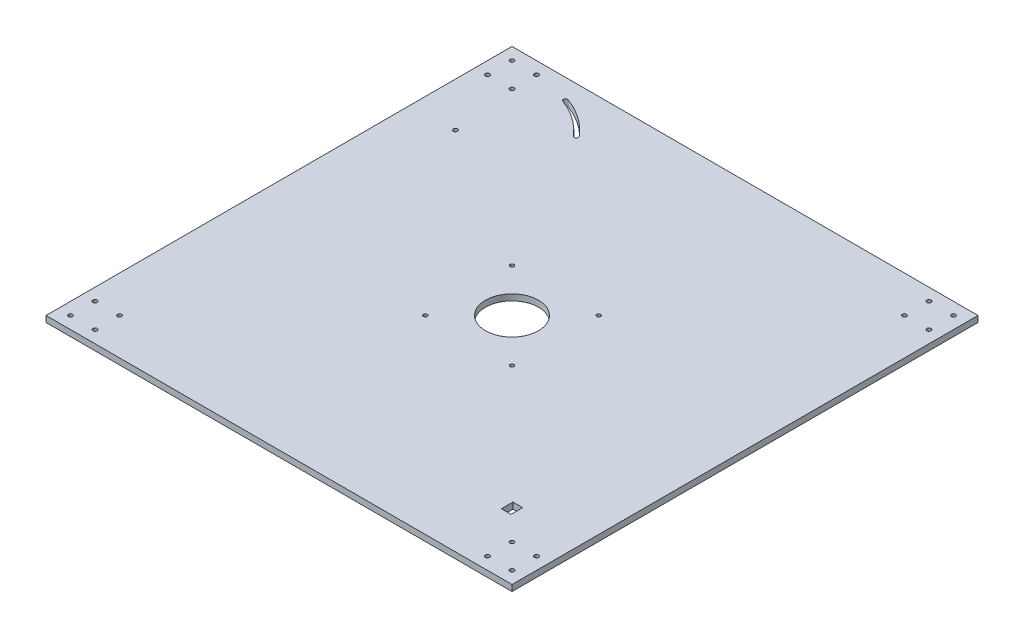
from build123d import *

# Parameters (mm, degrees)
SKETCH1_W               = 482.6
SKETCH1_H               = 482.6
BOSS_EXTRUDE1_DEPTH     = 6.35
CUT_EXTRUDE1_DEPTH      = 342.30880812
CUT_EXTRUDE1_DEPTH_BACK = 342.30880812
SKETCH2_R               = 1.984375
SKETCH2_R_2             = 27.432
SKETCH3_W               = 10
SKETCH3_H               = 12
CUT_EXTRUDE2_DEPTH      = 342.30880812
SKETCH4_R               = 2.1828125
CUT_EXTRUDE3_DEPTH      = 342.30880812
SKETCH5_R               = 2.1828125
CUT_EXTRUDE4_DEPTH      = 342.30880812


with BuildPart() as part:
    # Sketch1 → Boss-Extrude1 (new body)
    with BuildSketch(Plane(origin=(0, 0, 0), x_dir=(1, 0, 0), z_dir=(0, 1, 0))):
        Rectangle(SKETCH1_W, SKETCH1_H)
    extrude(amount=BOSS_EXTRUDE1_DEPTH)

    # Sketch2 → Cut-Extrude1 (cut, two sides: drawn at the far end of the back side and taken through both)
    with BuildSketch(Plane(origin=(0, 6.35, 0), x_dir=(1, 0, 0), z_dir=(0, 1, 0)).offset(-CUT_EXTRUDE1_DEPTH_BACK)):
        with Locations((-44.8437, 44.8437)):
            Circle(SKETCH2_R)
        with Locations((44.8437, 44.8437)):
            Circle(SKETCH2_R)
        with Locations((-44.8437, -44.8437)):
            Circle(SKETCH2_R)
        with Locations((44.8437, -44.8437)):
            Circle(SKETCH2_R)
        Circle(SKETCH2_R_2)
    extrude(amount=CUT_EXTRUDE1_DEPTH + CUT_EXTRUDE1_DEPTH_BACK, mode=Mode.SUBTRACT)

    # Sketch3 → Cut-Extrude2 (cut, through all)
    with BuildSketch(Plane(origin=(0, 6.35, 0), x_dir=(1, 0, 0), z_dir=(0, 1, 0))):
        with Locations((172.869930331, -172.869930331)):
            Rectangle(SKETCH3_W, SKETCH3_H)
    extrude(amount=-CUT_EXTRUDE2_DEPTH, mode=Mode.SUBTRACT)

    # Sketch4 → Cut-Extrude3 (cut, through all)
    with BuildSketch(Plane(origin=(0, 6.35, 0), x_dir=(1, 0, 0), z_dir=(0, 1, 0))):
        with Locations((-228.6, 228.6)):
            Circle(SKETCH4_R)
        with Locations((-203.2, 228.6)):
            Circle(SKETCH4_R)
        with Locations((-228.6, 203.2)):
            Circle(SKETCH4_R)
        with Locations((-203.2, 203.2)):
            Circle(SKETCH4_R)
        with Locations((203.2, 228.6)):
            Circle(SKETCH4_R)
        with Locations((203.2, 203.2)):
            Circle(SKETCH4_R)
        with Locations((228.6, 203.2)):
            Circle(SKETCH4_R)
        with Locations((228.6, 228.6)):
            Circle(SKETCH4_R)
        with Locations((203.2, -203.2)):
            Circle(SKETCH4_R)
        with Locations((228.6, -203.2)):
            Circle(SKETCH4_R)
        with Locations((228.6, -228.6)):
            Circle(SKETCH4_R)
        with Locations((203.2, -228.6)):
            Circle(SKETCH4_R)
        with Locations((-228.6, -203.2)):
            Circle(SKETCH4_R)
        with Locations((-203.2, -203.2)):
            Circle(SKETCH4_R)
        with Locations((-203.2, -228.6)):
            Circle(SKETCH4_R)
        with Locations((-228.6, -228.6)):
            Circle(SKETCH4_R)
    extrude(amount=-CUT_EXTRUDE3_DEPTH, mode=Mode.SUBTRACT)

    # Sketch5 → Cut-Extrude4 (cut, through all)
    with BuildSketch(Plane(origin=(0, 6.35, 0), x_dir=(1, 0, 0), z_dir=(0, 1, 0))):
        with Locations((-195.580742094, 136.947109943)):
            Circle(SKETCH5_R)
        with BuildLine():
            ThreePointArc((-125.807259715, 195.494013274), (-143.337787088, 211.557782002), (-164.428585509, 222.53695673))
            ThreePointArc((-164.428585509, 222.53695673), (-167.226324152, 221.232349775), (-165.921717197, 218.434611132))
            ThreePointArc((-165.921717197, 218.434611132), (-145.841806718, 207.981671359), (-129.151522487, 192.687843615))
            ThreePointArc((-129.151522487, 192.687843615), (-126.076306272, 192.418797058), (-125.807259715, 195.494013274))
        make_face()
    extrude(amount=-CUT_EXTRUDE4_DEPTH, mode=Mode.SUBTRACT)


solid = part.part
